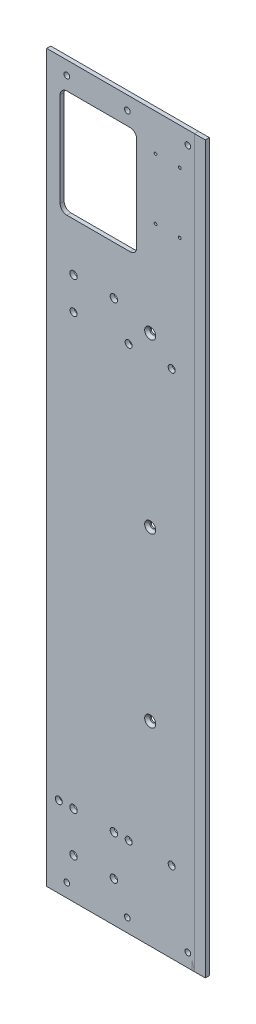
from build123d import *

# Parameters (mm, degrees)
SKETCH_1_W           = 150
SKETCH_1_H           = 540
EXTRUDE_1_DEPTH      = 3
SKETCH_2_R           = 2.1
SKETCH_2_R_2         = 1.6
CUT_EXTRUDE_1_DEPTH  = 281.239183556
CUT_EXTRUDE_2_REACH  = 282.239
SKETCH_4_R           = 2.1
CHAMFER_1_SIZE       = 2
CUT_EXTRUDE_4_REACH  = 282.239
SKETCH_6_R           = 2.6
CUT_EXTRUDE_5_REACH  = 282.239
SKETCH_7_R           = 2.75
CUT_EXTRUDE_6_REACH  = 282.239
SKETCH_8_R           = 2.75
SKETCH_9_R           = 2.75
CUT_EXTRUDE_7_DEPTH  = 10
CUT_EXTRUDE_START    = -10
SKETCH_10_W          = 57
SKETCH_10_H          = 80
SKETCH_10_R          = 1.6
CUT_EXTRUDE_8_DEPTH  = 10
FILLET_1_R           = 5
SKETCH_11_R          = 1
CUT_EXTRUDE_9_DEPTH  = 4
SKETCH_13_W          = 40
SKETCH_13_H          = 540
SKETCH_13_R          = 2.1
SKETCH_13_R_2        = 2.6
CUT_EXTRUDE_10_DEPTH = 10
SKETCH_14_W          = 10
SKETCH_14_H          = 540
EXTRUDE_2_DEPTH      = 3


with BuildPart() as part:
    # 草图1 → 凸台-拉伸1 (new body)
    with BuildSketch(Plane.XY):
        Rectangle(SKETCH_1_W, SKETCH_1_H)
    extrude(amount=EXTRUDE_1_DEPTH)

    # 草图2 → 切除-拉伸1 (cut, through all)
    with BuildSketch(Plane(origin=(0, 0, 0), x_dir=(-1, 0, 0), z_dir=(0, 0, -1))):
        with Locations((65, -260)):
            Circle(SKETCH_2_R)
        with Locations((-70, -260)):
            Circle(SKETCH_2_R)
        with Locations((65, 260)):
            Circle(SKETCH_2_R)
        with Locations((-70, 260)):
            Circle(SKETCH_2_R)
        with Locations((-25, -260)):
            Circle(SKETCH_2_R)
        with Locations((20, -260)):
            Circle(SKETCH_2_R)
        with Locations((20, 260)):
            Circle(SKETCH_2_R)
        with Locations((-25, 260)):
            Circle(SKETCH_2_R)
        with Locations((15, 196.5)):
            Circle(SKETCH_2_R_2)
        with Locations((15, 188.5)):
            Circle(SKETCH_2_R_2)
        with Locations((-15, 196.5)):
            Circle(SKETCH_2_R_2)
        with Locations((-15, 188.5)):
            Circle(SKETCH_2_R_2)
    extrude(amount=-CUT_EXTRUDE_1_DEPTH, mode=Mode.SUBTRACT)

    # 草图4 → 切除-拉伸2 (cut, up to next)
    with BuildSketch(Plane.XY.offset(3), mode=Mode.PRIVATE) as cut_extrude_2_sk1:
        with Locations((42, 125)):
            Circle(SKETCH_4_R)
    cut_extrude_2_tool1 = extrude(cut_extrude_2_sk1.sketch, amount=-CUT_EXTRUDE_2_REACH, mode=Mode.PRIVATE) & part.part
    # 草图4 → 切除-拉伸2 (cut, up to next)
    with BuildSketch(Plane.XY.offset(3), mode=Mode.PRIVATE) as cut_extrude_2_sk2:
        with Locations((42, -125)):
            Circle(SKETCH_4_R)
    cut_extrude_2_tool2 = extrude(cut_extrude_2_sk2.sketch, amount=-CUT_EXTRUDE_2_REACH, mode=Mode.PRIVATE) & part.part
    # 草图4 → 切除-拉伸2 (cut, up to next)
    with BuildSketch(Plane.XY.offset(3), mode=Mode.PRIVATE) as cut_extrude_2_sk3:
        with Locations((42, 0)):
            Circle(SKETCH_4_R)
    cut_extrude_2_tool3 = extrude(cut_extrude_2_sk3.sketch, amount=-CUT_EXTRUDE_2_REACH, mode=Mode.PRIVATE) & part.part
    # 草图4 → 切除-拉伸2 (cut, up to next)
    with BuildSketch(Plane.XY.offset(3), mode=Mode.PRIVATE) as cut_extrude_2_sk4:
        with Locations((-42, 0)):
            Circle(SKETCH_4_R)
    cut_extrude_2_tool4 = extrude(cut_extrude_2_sk4.sketch, amount=-CUT_EXTRUDE_2_REACH, mode=Mode.PRIVATE) & part.part
    # 草图4 → 切除-拉伸2 (cut, up to next)
    with BuildSketch(Plane.XY.offset(3), mode=Mode.PRIVATE) as cut_extrude_2_sk5:
        with Locations((-42, -125)):
            Circle(SKETCH_4_R)
    cut_extrude_2_tool5 = extrude(cut_extrude_2_sk5.sketch, amount=-CUT_EXTRUDE_2_REACH, mode=Mode.PRIVATE) & part.part
    # 草图4 → 切除-拉伸2 (cut, up to next)
    with BuildSketch(Plane.XY.offset(3), mode=Mode.PRIVATE) as cut_extrude_2_sk6:
        with Locations((-42, 125)):
            Circle(SKETCH_4_R)
    cut_extrude_2_tool6 = extrude(cut_extrude_2_sk6.sketch, amount=-CUT_EXTRUDE_2_REACH, mode=Mode.PRIVATE) & part.part
    add(cut_extrude_2_tool1.solids().sort_by_distance((42, 125, 3))[0], mode=Mode.SUBTRACT)
    add(cut_extrude_2_tool2.solids().sort_by_distance((42, -125, 3))[0], mode=Mode.SUBTRACT)
    add(cut_extrude_2_tool3.solids().sort_by_distance((42, 0, 3))[0], mode=Mode.SUBTRACT)
    add(cut_extrude_2_tool4.solids().sort_by_distance((-42, 0, 3))[0], mode=Mode.SUBTRACT)
    add(cut_extrude_2_tool5.solids().sort_by_distance((-42, -125, 3))[0], mode=Mode.SUBTRACT)
    add(cut_extrude_2_tool6.solids().sort_by_distance((-42, 125, 3))[0], mode=Mode.SUBTRACT)

    # 倒角1
    chamfer_1_edges = [part.edges().sort_by_distance(p)[0] for p in [
        (39.9, 0, 3),
        (39.9, -125, 3),
        (39.9, 125, 3),
    ]]
    chamfer(chamfer_1_edges, length=CHAMFER_1_SIZE)

    # 草图6 → 切除-拉伸4 (cut, up to next)
    with BuildSketch(Plane.XY.offset(3), mode=Mode.PRIVATE) as cut_extrude_4_sk1:
        with Locations((26, -210)):
            Circle(SKETCH_6_R)
    cut_extrude_4_tool1 = extrude(cut_extrude_4_sk1.sketch, amount=-CUT_EXTRUDE_4_REACH, mode=Mode.PRIVATE) & part.part
    # 草图6 → 切除-拉伸4 (cut, up to next)
    with BuildSketch(Plane.XY.offset(3), mode=Mode.PRIVATE) as cut_extrude_4_sk2:
        with Locations((-26, -210)):
            Circle(SKETCH_6_R)
    cut_extrude_4_tool2 = extrude(cut_extrude_4_sk2.sketch, amount=-CUT_EXTRUDE_4_REACH, mode=Mode.PRIVATE) & part.part
    # 草图6 → 切除-拉伸4 (cut, up to next)
    with BuildSketch(Plane.XY.offset(3), mode=Mode.PRIVATE) as cut_extrude_4_sk3:
        with Locations((58, -210)):
            Circle(SKETCH_6_R)
    cut_extrude_4_tool3 = extrude(cut_extrude_4_sk3.sketch, amount=-CUT_EXTRUDE_4_REACH, mode=Mode.PRIVATE) & part.part
    # 草图6 → 切除-拉伸4 (cut, up to next)
    with BuildSketch(Plane.XY.offset(3), mode=Mode.PRIVATE) as cut_extrude_4_sk4:
        with Locations((-58, -210)):
            Circle(SKETCH_6_R)
    cut_extrude_4_tool4 = extrude(cut_extrude_4_sk4.sketch, amount=-CUT_EXTRUDE_4_REACH, mode=Mode.PRIVATE) & part.part
    # 草图6 → 切除-拉伸4 (cut, up to next)
    with BuildSketch(Plane.XY.offset(3), mode=Mode.PRIVATE) as cut_extrude_4_sk5:
        with Locations((-47, 110)):
            Circle(SKETCH_6_R)
    cut_extrude_4_tool5 = extrude(cut_extrude_4_sk5.sketch, amount=-CUT_EXTRUDE_4_REACH, mode=Mode.PRIVATE) & part.part
    # 草图6 → 切除-拉伸4 (cut, up to next)
    with BuildSketch(Plane.XY.offset(3), mode=Mode.PRIVATE) as cut_extrude_4_sk6:
        with Locations((-15, 110)):
            Circle(SKETCH_6_R)
    cut_extrude_4_tool6 = extrude(cut_extrude_4_sk6.sketch, amount=-CUT_EXTRUDE_4_REACH, mode=Mode.PRIVATE) & part.part
    # 草图6 → 切除-拉伸4 (cut, up to next)
    with BuildSketch(Plane.XY.offset(3), mode=Mode.PRIVATE) as cut_extrude_4_sk7:
        with Locations((26, 110)):
            Circle(SKETCH_6_R)
    cut_extrude_4_tool7 = extrude(cut_extrude_4_sk7.sketch, amount=-CUT_EXTRUDE_4_REACH, mode=Mode.PRIVATE) & part.part
    # 草图6 → 切除-拉伸4 (cut, up to next)
    with BuildSketch(Plane.XY.offset(3), mode=Mode.PRIVATE) as cut_extrude_4_sk8:
        with Locations((58, 110)):
            Circle(SKETCH_6_R)
    cut_extrude_4_tool8 = extrude(cut_extrude_4_sk8.sketch, amount=-CUT_EXTRUDE_4_REACH, mode=Mode.PRIVATE) & part.part
    add(cut_extrude_4_tool1.solids().sort_by_distance((26, -210, 3))[0], mode=Mode.SUBTRACT)
    add(cut_extrude_4_tool2.solids().sort_by_distance((-26, -210, 3))[0], mode=Mode.SUBTRACT)
    add(cut_extrude_4_tool3.solids().sort_by_distance((58, -210, 3))[0], mode=Mode.SUBTRACT)
    add(cut_extrude_4_tool4.solids().sort_by_distance((-58, -210, 3))[0], mode=Mode.SUBTRACT)
    add(cut_extrude_4_tool5.solids().sort_by_distance((-47, 110, 3))[0], mode=Mode.SUBTRACT)
    add(cut_extrude_4_tool6.solids().sort_by_distance((-15, 110, 3))[0], mode=Mode.SUBTRACT)
    add(cut_extrude_4_tool7.solids().sort_by_distance((26, 110, 3))[0], mode=Mode.SUBTRACT)
    add(cut_extrude_4_tool8.solids().sort_by_distance((58, 110, 3))[0], mode=Mode.SUBTRACT)

    # 草图7 → 切除-拉伸5 (cut, up to next)
    with BuildSketch(Plane.XY.offset(3), mode=Mode.PRIVATE) as cut_extrude_5_sk1:
        with Locations((-15, 134)):
            Circle(SKETCH_7_R)
    cut_extrude_5_tool1 = extrude(cut_extrude_5_sk1.sketch, amount=-CUT_EXTRUDE_5_REACH, mode=Mode.PRIVATE) & part.part
    # 草图7 → 切除-拉伸5 (cut, up to next)
    with BuildSketch(Plane.XY.offset(3), mode=Mode.PRIVATE) as cut_extrude_5_sk2:
        with Locations((15, 134)):
            Circle(SKETCH_7_R)
    cut_extrude_5_tool2 = extrude(cut_extrude_5_sk2.sketch, amount=-CUT_EXTRUDE_5_REACH, mode=Mode.PRIVATE) & part.part
    add(cut_extrude_5_tool1.solids().sort_by_distance((-15, 134, 3))[0], mode=Mode.SUBTRACT)
    add(cut_extrude_5_tool2.solids().sort_by_distance((15, 134, 3))[0], mode=Mode.SUBTRACT)

    # 草图8 → 切除-拉伸6 (cut, up to next)
    with BuildSketch(Plane.XY.offset(3), mode=Mode.PRIVATE) as cut_extrude_6_sk1:
        with Locations((-15, -210)):
            Circle(SKETCH_8_R)
    cut_extrude_6_tool1 = extrude(cut_extrude_6_sk1.sketch, amount=-CUT_EXTRUDE_6_REACH, mode=Mode.PRIVATE) & part.part
    # 草图8 → 切除-拉伸6 (cut, up to next)
    with BuildSketch(Plane.XY.offset(3), mode=Mode.PRIVATE) as cut_extrude_6_sk2:
        with Locations((15, -210)):
            Circle(SKETCH_8_R)
    cut_extrude_6_tool2 = extrude(cut_extrude_6_sk2.sketch, amount=-CUT_EXTRUDE_6_REACH, mode=Mode.PRIVATE) & part.part
    add(cut_extrude_6_tool1.solids().sort_by_distance((-15, -210, 3))[0], mode=Mode.SUBTRACT)
    add(cut_extrude_6_tool2.solids().sort_by_distance((15, -210, 3))[0], mode=Mode.SUBTRACT)

    # 草图9 → 切除-拉伸7 (cut)
    with BuildSketch(Plane.XY.offset(3)):
        with Locations((-15, -240)):
            Circle(SKETCH_9_R)
        with Locations((15, -240)):
            Circle(SKETCH_9_R)
    extrude(amount=-CUT_EXTRUDE_7_DEPTH, mode=Mode.SUBTRACT)

    # 草图10 → 切除-拉伸8 (cut)
    with BuildSketch(Plane.XY.offset(3).offset(CUT_EXTRUDE_START)):
        with Locations((3.5, 210)):
            Rectangle(SKETCH_10_W, SKETCH_10_H)
        with Locations((-15, 188.5)):
            Circle(SKETCH_10_R, mode=Mode.SUBTRACT)
        with Locations((-15, 196.5)):
            Circle(SKETCH_10_R, mode=Mode.SUBTRACT)
        with Locations((15, 196.5)):
            Circle(SKETCH_10_R, mode=Mode.SUBTRACT)
        with Locations((15, 188.5)):
            Circle(SKETCH_10_R, mode=Mode.SUBTRACT)
    extrude(amount=CUT_EXTRUDE_8_DEPTH, mode=Mode.SUBTRACT)

    # 圆角1
    fillet_1_edges = [part.edges().sort_by_distance(p)[0] for p in [
        (-25, 170, 1.5),
        (-25, 250, 1.5),
        (32, 170, 1.5),
        (32, 250, 1.5),
    ]]
    fillet(fillet_1_edges, radius=FILLET_1_R)

    # 草图11 → 切除-拉伸9 (cut)
    with BuildSketch(Plane.XY.offset(3)):
        with Locations((46, 242.6)):
            Circle(SKETCH_11_R)
        with Locations((64, 242.6)):
            Circle(SKETCH_11_R)
        with Locations((64, 197.4)):
            Circle(SKETCH_11_R)
        with Locations((46, 197.4)):
            Circle(SKETCH_11_R)
    extrude(amount=-CUT_EXTRUDE_9_DEPTH, mode=Mode.SUBTRACT)

    # 草图13 → 切除-拉伸10 (cut)
    with BuildSketch(Plane.XY.offset(3)):
        with Locations((-55, 0)):
            Rectangle(SKETCH_13_W, SKETCH_13_H)
        with Locations((-65, -260)):
            Circle(SKETCH_13_R, mode=Mode.SUBTRACT)
        with Locations((-58, -210)):
            Circle(SKETCH_13_R_2, mode=Mode.SUBTRACT)
        with Locations((-47, 110)):
            Circle(SKETCH_13_R_2, mode=Mode.SUBTRACT)
        with Locations((-65, 260)):
            Circle(SKETCH_13_R, mode=Mode.SUBTRACT)
    extrude(amount=-CUT_EXTRUDE_10_DEPTH, mode=Mode.SUBTRACT)


with BuildPart() as body_2:
    # 草图14 → 凸台-拉伸2 (new body)
    with BuildSketch(Plane.XY.offset(3)):
        with Locations((78, 0)):
            Rectangle(SKETCH_14_W, SKETCH_14_H)
    extrude(amount=-EXTRUDE_2_DEPTH)


solid = Compound([part.part, body_2.part])
